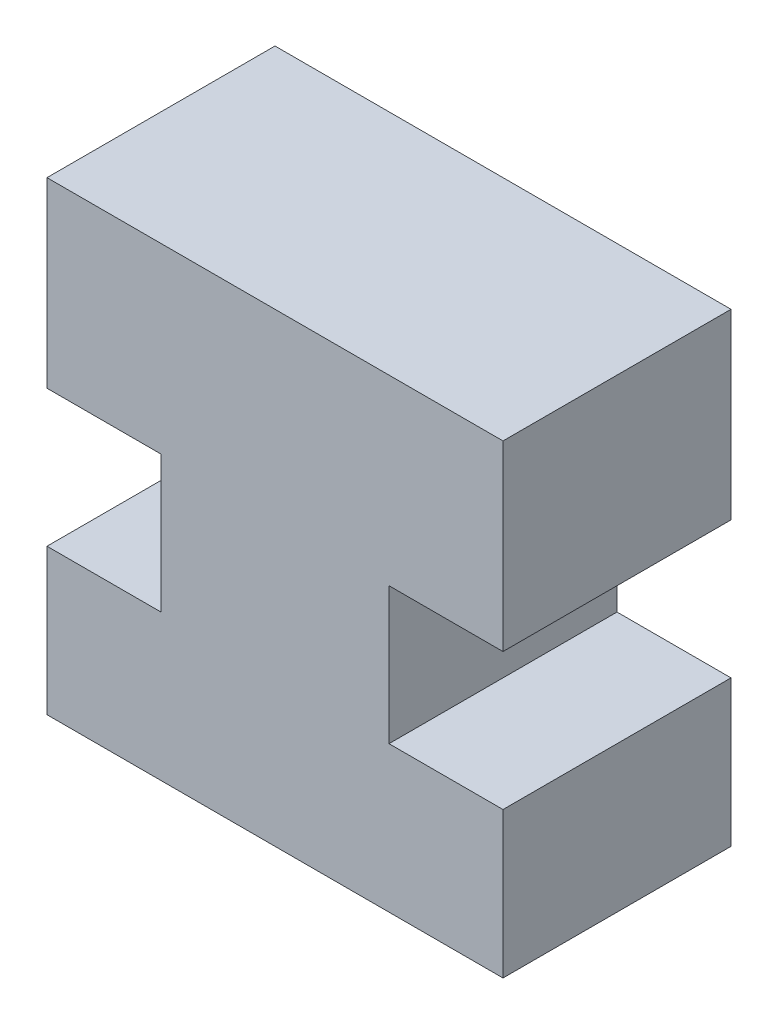
from build123d import *

# Parameters (mm, degrees)
BODY_DEPTH = 6.35


with BuildPart() as part:
    # Sketch2 → body (new body)
    with BuildSketch(Plane.XY):
        Polygon((0, 0), (12.7, 0), (12.7, -5.08), (9.525, -5.08), (9.525, -8.89), (12.7, -8.89), (12.7, -12.954), (0, -12.954), (0, -8.89), (3.175, -8.89), (3.175, -5.08), (0, -5.08), align=None)
    extrude(amount=BODY_DEPTH)


solid = part.part
